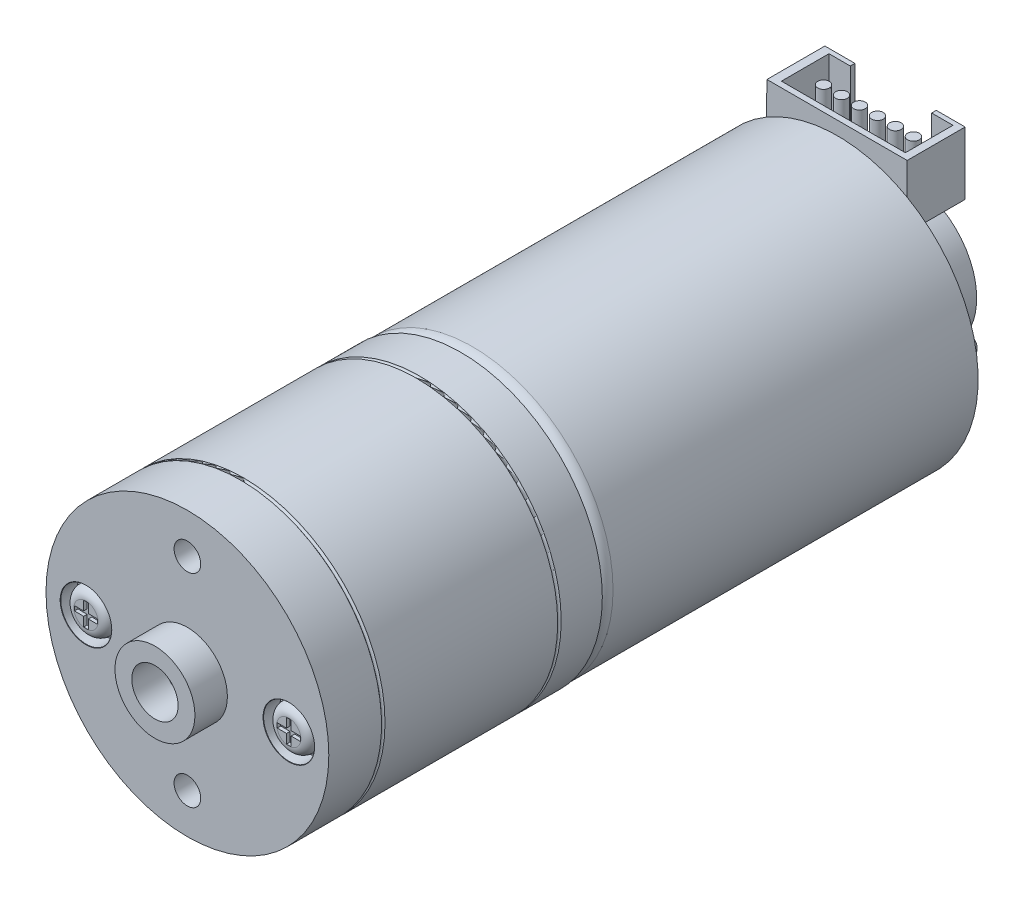
from build123d import *

# Parameters (mm, degrees)
SKETCH1_R                                  = 12.125
BOSS_EXTRUDE1_DEPTH                        = 31
FILLET2_R                                  = 1
SHELL1_START                               = 1
SHELL1_OUTLINE_R                           = 11.125
SHELL1_DEPTH                               = 30
SKETCH11_R                                 = 12.2
BOSS_EXTRUDE4_DEPTH                        = 23.6
SKETCH12_R                                 = 3.45
SKETCH12_R_2                               = 2
BOSS_EXTRUDE5_DEPTH                        = 2.8
SKETCH17_R                                 = 0.15
SKETCH18_R                                 = 1.15
CUT_EXTRUDE7_DEPTH                         = 10
CBORE_FOR_M2_CHEESE_HEAD_SCREW1_AT_2_COUNT = 2
CBORE_FOR_M2_CHEESE_HEAD_SCREW1_AT_2_PITCH = 17.5
SKETCH24_R                                 = 1.842235559
BOSS_EXTRUDE7_DEPTH                        = 1.4
CUT_EXTRUDE9_DEPTH                         = 0.3
FILLET3_R                                  = 0.8
FILLET3_OF_MIRROR2_R                       = 0.8
BOSS_EXTRUDE8_START                        = 1.5
SKETCH26_R                                 = 12.125
BOSS_EXTRUDE8_DEPTH                        = 1.5
BOSS_EXTRUDE9_START                        = 1
SKETCH27_R                                 = 6
BOSS_EXTRUDE9_DEPTH                        = 5
SKETCH28_R                                 = 0.75
BOSS_EXTRUDE10_DEPTH                       = 8
BOSS_EXTRUDE11_DEPTH                       = 5
SKETCH31_W                                 = 7.02358916
SKETCH31_H                                 = 2.353363912
SKETCH31_H_2                               = 0.39838489
CUT_EXTRUDE10_DEPTH                        = 4.5
SKETCH32_R                                 = 0.5
BOSS_EXTRUDE12_DEPTH                       = 4
BOSS_EXTRUDE13_DEPTH                       = 4
SKETCH33_4_W                               = 2.145707953
SKETCH33_4_H                               = 1.092403472
SKETCH33_4_W_2                             = 0.820417747
SKETCH33_4_H_2                             = 2.019489838
BOSS_EXTRUDE14_DEPTH                       = 1


# Read off the part's stored shape, not the designer's step: Shell1
with BuildPart() as part:
    # Sketch1 → Boss-Extrude1 (new body)
    with BuildSketch(Plane.XY):
        Circle(SKETCH1_R)
    extrude(amount=BOSS_EXTRUDE1_DEPTH)

    # Fillet2
    fillet2_edges = [part.edges().sort_by_distance(p)[0] for p in [
        (-12.125, 0, 31),
    ]]
    fillet(fillet2_edges, radius=FILLET2_R)

    # Shell1 outline → Shell1 (cut)
    with BuildSketch(Plane.XY.offset(SHELL1_START)):
        Circle(SHELL1_OUTLINE_R)
    extrude(amount=SHELL1_DEPTH, mode=Mode.SUBTRACT)

    # Sketch26 → Boss-Extrude8 (add)
    with BuildSketch(Plane(origin=(0, 0, 0), x_dir=(-1, 0, 0), z_dir=(0, 0, -1)).offset(BOSS_EXTRUDE8_START)):
        Circle(SKETCH26_R)
    extrude(amount=-BOSS_EXTRUDE8_DEPTH)



with BuildPart() as body_2:
    # Sketch11 → Boss-Extrude4 (new body)
    with BuildSketch(Plane.XY.offset(31)):
        Circle(SKETCH11_R)
    extrude(amount=BOSS_EXTRUDE4_DEPTH)

    # Sketch12 → Boss-Extrude5 (add)
    with BuildSketch(Plane.XY.offset(54.6)):
        Circle(SKETCH12_R)
        Circle(SKETCH12_R_2, mode=Mode.SUBTRACT)
    extrude(amount=BOSS_EXTRUDE5_DEPTH)

    # Sketch17 → Cut-Revolve1 (revolve, cut)
    with BuildSketch(Plane(origin=(0, 0, 0), x_dir=(1, 0, 0), z_dir=(0, 1, 0))):
        with Locations((-12.2, -49.9)):
            Circle(SKETCH17_R)
        with Locations((-12.2, -34.7)):
            Circle(SKETCH17_R)
    revolve(axis=Axis((0, 0, 54.6), (0, 0, -1)), mode=Mode.SUBTRACT)

    # Sketch18 → Cut-Extrude7 (cut)
    with BuildSketch(Plane.XY.offset(54.6)):
        with Locations((0, 8.75)):
            Circle(SKETCH18_R)
        with Locations(Location((0, -8.75, 0), (0, 0, 180))):
            Circle(SKETCH18_R)
    extrude(amount=-CUT_EXTRUDE7_DEPTH, mode=Mode.SUBTRACT)

    # Sketch23 → CBORE for M2 Cheese Head Screw1 (revolve, cut)
    with BuildSketch(Plane(origin=(-8.75, 0, 54.6), x_dir=(0, -1, 0), z_dir=(1, 0, 0))):
        Polygon((0, 0), (0, 5.781118805), (1.3, 5), (1.3, 1.4), (2.2, 1.4), (2.2, 0.025), (2.225, 0), align=None)
    cbore_for_m2_cheese_head_screw1 = revolve(axis=Axis((-8.75, 0, 60.95), (0, 0, -1)), mode=Mode.SUBTRACT)

    # CBORE for M2 Cheese Head Screw1 at 2: CBORE for M2 Cheese Head Screw1 ×2
    with Locations(*[(i * CBORE_FOR_M2_CHEESE_HEAD_SCREW1_AT_2_PITCH, 0, 0) for i in range(1, CBORE_FOR_M2_CHEESE_HEAD_SCREW1_AT_2_COUNT)]):
        add(cbore_for_m2_cheese_head_screw1, mode=Mode.SUBTRACT)

    # Sketch24 → Boss-Extrude7 (add)
    with BuildSketch(Plane.XY.offset(53.2)):
        with Locations(Location((-8.75, 0, 0), (0, 0, 180))):
            Circle(SKETCH24_R)
    boss_extrude7 = extrude(amount=BOSS_EXTRUDE7_DEPTH)

    # Sketch25 → Cut-Extrude9 (cut)
    with BuildSketch(Plane.XY.offset(54.6)):
        Polygon((-8.55, 0.2), (-7.75, 0.2), (-7.75, -0.2), (-8.55, -0.2), (-8.55, -1), (-8.95, -1), (-8.95, -0.2), (-9.75, -0.2), (-9.75, 0.2), (-8.95, 0.2), (-8.95, 1), (-8.55, 1), align=None)
    cut_extrude9 = extrude(amount=-CUT_EXTRUDE9_DEPTH, mode=Mode.SUBTRACT)

    # Fillet3
    fillet3_edges = [body_2.edges().sort_by_distance(p)[0] for p in [
        (-6.907764441, 0, 54.6),
    ]]
    fillet(fillet3_edges, radius=FILLET3_R)

    # Mirror2: Boss-Extrude7, Cut-Extrude9 across plane
    add(boss_extrude7.mirror(Plane(origin=(0, 0, 0), x_dir=(0, 0, 1), z_dir=(1, 0, 0))))
    add(cut_extrude9.mirror(Plane(origin=(0, 0, 0), x_dir=(0, 0, 1), z_dir=(1, 0, 0))), mode=Mode.SUBTRACT)

    # Fillet3 of Mirror2
    fillet3_of_mirror2_edges = [body_2.edges().sort_by_distance(p)[0] for p in [
        (6.907764441, 0, 54.6),
    ]]
    fillet(fillet3_of_mirror2_edges, radius=FILLET3_OF_MIRROR2_R)


with BuildPart() as body_3:
    # Sketch27 → Boss-Extrude9 (new body)
    with BuildSketch(Plane(origin=(0, 0, -1.5), x_dir=(-1, 0, 0), z_dir=(0, 0, -1)).offset(BOSS_EXTRUDE9_START)):
        Circle(SKETCH27_R)
    extrude(amount=BOSS_EXTRUDE9_DEPTH)


with BuildPart() as part_1:
    add(part.part)

    add(body_3.part)  # Boss-Extrude10 merges body 3
    # Sketch28 → Boss-Extrude10 (add)
    with BuildSketch(Plane(origin=(0, 0, -1.5), x_dir=(-1, 0, 0), z_dir=(0, 0, -1))):
        Circle(SKETCH28_R)
    extrude(amount=BOSS_EXTRUDE10_DEPTH)

    # Sketch29 → Boss-Extrude11 (add)
    with BuildSketch(Plane(origin=(0, 0, -1.5), x_dir=(-1, 0, 0), z_dir=(0, 0, -1))):
        Polygon((6.099445351, 13.287426403), (-6, 13.287426403), (-6, 7.871973463), (6.178591018, 7.871973463), align=None)
    extrude(amount=BOSS_EXTRUDE11_DEPTH)

    # Sketch31 → Cut-Extrude10 (cut)
    with BuildSketch(Plane(origin=(0, 13.287426403, 0), x_dir=(1, 0, 0), z_dir=(0, 1, 0))):
        Polygon((5.348948358, 1.998835879), (5.348948358, 6.10161511), (3.51179458, 6.10161511), (3.51179458, 3.748251198), (-3.51179458, 3.748251198), (-3.51179458, 6.10161511), (-5.348948358, 6.10161511), (-5.348948358, 1.998835879), align=None)
        with Locations((0, 4.924933154)):
            Rectangle(SKETCH31_W, SKETCH31_H)
        with Locations((0, 6.300807555)):
            Rectangle(SKETCH31_W, SKETCH31_H_2)
    extrude(amount=-CUT_EXTRUDE10_DEPTH, mode=Mode.SUBTRACT)

    # Sketch32 → Boss-Extrude12 (add)
    with BuildSketch(Plane(origin=(0, 8.787426403, 0), x_dir=(1, 0, 0), z_dir=(0, 1, 0))):
        with Locations(Location((3.980307899, 4.055615649, 0), (0, 0, 180))):
            Circle(SKETCH32_R)
        with Locations(Location((2.430307899, 4.055615649, 0), (0, 0, 180))):
            Circle(SKETCH32_R)
        with Locations(Location((0.880307899, 4.055615649, 0), (0, 0, 180))):
            Circle(SKETCH32_R)
        with Locations(Location((-0.669692101, 4.055615649, 0), (0, 0, 180))):
            Circle(SKETCH32_R)
        with Locations(Location((-2.219692101, 4.055615649, 0), (0, 0, 180))):
            Circle(SKETCH32_R)
        with Locations(Location((-3.769692101, 4.055615649, 0), (0, 0, 180))):
            Circle(SKETCH32_R)
    extrude(amount=BOSS_EXTRUDE12_DEPTH)

    # Sketch33 → Boss-Extrude13 (add)
    with BuildSketch(Plane(origin=(0, 0, -1.5), x_dir=(-1, 0, 0), z_dir=(0, 0, -1))):
        with BuildLine():
            Line((6.485003155, -4.688937379), (7.887571356, -2.036994234))
            ThreePointArc((7.887571356, -2.036994234), (7.57522762, -1.023366398), (6.561599784, -1.335710134))
            Line((6.561599784, -1.335710134), (5.159031583, -3.987653278))
            ThreePointArc((5.159031583, -3.987653278), (5.471375319, -5.001281114), (6.485003155, -4.688937379))
        make_face()
        with BuildLine():
            ThreePointArc((-6.654317468, -1.338157716), (-7.684851268, -1.087159533), (-7.935849451, -2.117693332))
            Line((-7.935849451, -2.117693332), (-6.376778219, -4.680757298))
            ThreePointArc((-6.376778219, -4.680757298), (-5.34624442, -4.931755482), (-5.095246236, -3.901221682))
            Line((-5.095246236, -3.901221682), (-6.654317468, -1.338157716))
        make_face()
    extrude(amount=BOSS_EXTRUDE13_DEPTH)

    # Sketch33<4> → Boss-Extrude14 (add)
    with BuildSketch(Plane(origin=(0, 0, -1.5), x_dir=(-1, 0, 0), z_dir=(0, 0, -1))):
        with BuildLine():
            Line((5.159031583, -3.987653278), (6.561599784, -1.335710134))
            ThreePointArc((6.561599784, -1.335710134), (7.57522762, -1.023366398), (7.887571356, -2.036994234))
            Line((7.887571356, -2.036994234), (6.485003155, -4.688937379))
            ThreePointArc((6.485003155, -4.688937379), (5.471375319, -5.001281114), (5.159031583, -3.987653278))
        make_face()
        with BuildLine():
            Line((-6.376778219, -4.680757298), (-7.935849451, -2.117693332))
            ThreePointArc((-7.935849451, -2.117693332), (-7.684851268, -1.087159533), (-6.654317468, -1.338157716))
            Line((-6.654317468, -1.338157716), (-5.095246236, -3.901221682))
            ThreePointArc((-5.095246236, -3.901221682), (-5.34624442, -4.931755482), (-6.376778219, -4.680757298))
        make_face()
        with Locations((-9.583787275, 0)):
            Rectangle(SKETCH33_4_W, SKETCH33_4_H)
        with Locations((9.583787275, 0)):
            Rectangle(SKETCH33_4_W, SKETCH33_4_H)
        with Locations((2.168473025, -8.277061273)):
            Rectangle(SKETCH33_4_W_2, SKETCH33_4_H_2)
        with Locations((-2.168473025, -8.277061273)):
            Rectangle(SKETCH33_4_W_2, SKETCH33_4_H_2)
    extrude(amount=BOSS_EXTRUDE14_DEPTH)


solid = Compound([body_2.part, part_1.part])
